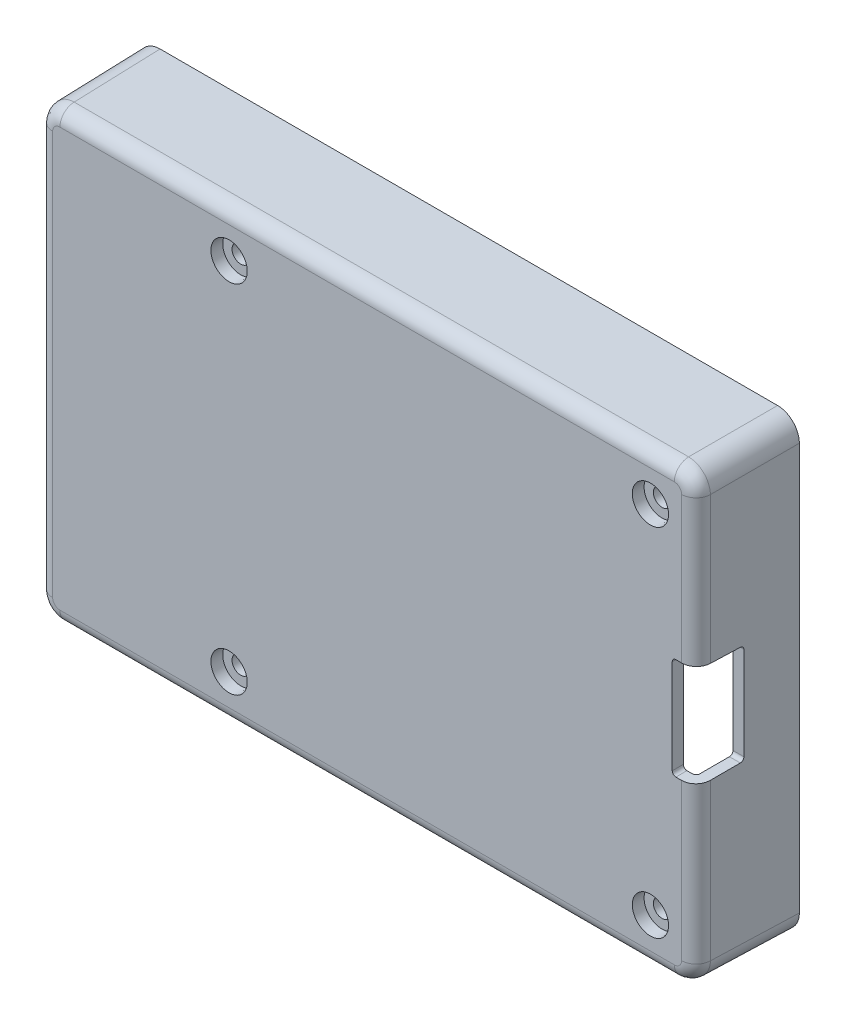
from build123d import *

# Parameters (mm, degrees)
SKETCH1_R                                        = 3.5
STANDOFFS_DEPTH                                  = 6
STANDOFFS_DRAFT                                  = -1
STANDOFFS_PROFILE_2_DEPTH                        = 6
STANDOFFS_PROFILE_2_DRAFT                        = -1
STANDOFFS_PROFILE_3_DEPTH                        = 6
STANDOFFS_PROFILE_3_DRAFT                        = -1
STANDOFFS_PROFILE_4_DEPTH                        = 6
STANDOFFS_PROFILE_4_DRAFT                        = -1
SKETCH2_W                                        = 91
SKETCH2_H                                        = 62
BASE_DEPTH                                       = 1.5
SKETCH3_W                                        = 91
SKETCH3_H                                        = 62
SKETCH3_W_2                                      = 88
SKETCH3_H_2                                      = 59
WALLS_DEPTH                                      = 12.5
CBORE_FOR_M2_PAN_HEAD_MACHINE_SCREW1_D           = 2.4
CBORE_FOR_M2_PAN_HEAD_MACHINE_SCREW1_CBORE_D     = 5
CBORE_FOR_M2_PAN_HEAD_MACHINE_SCREW1_CBORE_DEPTH = 1.6
SKETCH7_W                                        = 16
SKETCH7_H                                        = 6.92
SKETCH7_W_2                                      = 8.48
SKETCH7_H_2                                      = 7.06
SIDE_PORTS_DEPTH                                 = 56.634971016
SKETCH6_W                                        = 14.2
SKETCH6_H                                        = 17.304
SKETCH6_W_2                                      = 16.490000002
SKETCH6_H_2                                      = 14.78
ETHERNET_CUTS_DEPTH                              = 56.634971016
DRAFT2_ANGLE                                     = 1
DRAFT1_ANGLE                                     = -1
FILLET1_R                                        = 3
FILLET2_R                                        = 1.5
FILLET3_R                                        = 2
FILLET4_R                                        = 0.5
SD_START                                         = 42
SKETCH8_W                                        = 6.5
SKETCH8_H                                        = 14
SD_CARD_CUT_DEPTH                                = 14.634971168
DRAFT3_ANGLE                                     = 1
DRAFT4_ANGLE                                     = 1
DRAFT5_ANGLE                                     = 1
FILLET5_R                                        = 1
FILLET6_R                                        = 0.5


with BuildPart() as part:
    # Sketch1 → Standoffs (with draft: the straight prism first)
    with BuildSketch(Plane.XY):
        with Locations((-19, 24.5)):
            Circle(SKETCH1_R)
    extrude(amount=STANDOFFS_DEPTH)
    # Standoffs: the draft: its side faces are tilted about the plane it starts from
    standoffs_sides = [part.faces().sort_by_distance(p)[0] for p in [
        (-22.5, 24.5, 3),
    ]]
    draft(standoffs_sides, Plane.XY, STANDOFFS_DRAFT)



with BuildPart() as body_2:
    # Sketch1 → Standoffs profile 2 (with draft: the straight prism first)
    with BuildSketch(Plane.XY):
        with Locations((39, 24.5)):
            Circle(SKETCH1_R)
    extrude(amount=STANDOFFS_PROFILE_2_DEPTH)
    # Standoffs profile 2: the draft: its side faces are tilted about the plane it starts from
    standoffs_profile_2_sides = [body_2.faces().sort_by_distance(p)[0] for p in [
        (35.5, 24.5, 3),
    ]]
    draft(standoffs_profile_2_sides, Plane.XY, STANDOFFS_PROFILE_2_DRAFT)


with BuildPart() as body_3:
    # Sketch1 → Standoffs profile 3 (with draft: the straight prism first)
    with BuildSketch(Plane.XY):
        with Locations((39, -24.5)):
            Circle(SKETCH1_R)
    extrude(amount=STANDOFFS_PROFILE_3_DEPTH)
    # Standoffs profile 3: the draft: its side faces are tilted about the plane it starts from
    standoffs_profile_3_sides = [body_3.faces().sort_by_distance(p)[0] for p in [
        (35.5, -24.5, 3),
    ]]
    draft(standoffs_profile_3_sides, Plane.XY, STANDOFFS_PROFILE_3_DRAFT)


with BuildPart() as body_4:
    # Sketch1 → Standoffs profile 4 (with draft: the straight prism first)
    with BuildSketch(Plane.XY):
        with Locations((-19, -24.5)):
            Circle(SKETCH1_R)
    extrude(amount=STANDOFFS_PROFILE_4_DEPTH)
    # Standoffs profile 4: the draft: its side faces are tilted about the plane it starts from
    standoffs_profile_4_sides = [body_4.faces().sort_by_distance(p)[0] for p in [
        (-22.5, -24.5, 3),
    ]]
    draft(standoffs_profile_4_sides, Plane.XY, STANDOFFS_PROFILE_4_DRAFT)


with BuildPart() as part_1:
    add(part.part)

    add(body_2.part)  # Base merges body 2

    add(body_3.part)  # Base merges body 3

    add(body_4.part)  # Base merges body 4
    # Sketch2 → Base (add)
    with BuildSketch(Plane.XY.offset(6)):
        Rectangle(SKETCH2_W, SKETCH2_H)
    extrude(amount=-BASE_DEPTH)

    # Sketch3 → Walls (add)
    with BuildSketch(Plane(origin=(0, 0, 4.5), x_dir=(-1, 0, 0), z_dir=(0, 0, -1))):
        Rectangle(SKETCH3_W, SKETCH3_H)
        Rectangle(SKETCH3_W_2, SKETCH3_H_2, mode=Mode.SUBTRACT)
    extrude(amount=WALLS_DEPTH)

    # CBORE for M2 Pan Head Machine Screw1 (through all)
    with Locations(Plane.XY.offset(6)):
        with Locations((39, -24.5), (-19, 24.5), (39, 24.5), (-19, -24.5)):
            CounterBoreHole(CBORE_FOR_M2_PAN_HEAD_MACHINE_SCREW1_D / 2, CBORE_FOR_M2_PAN_HEAD_MACHINE_SCREW1_CBORE_D / 2, CBORE_FOR_M2_PAN_HEAD_MACHINE_SCREW1_CBORE_DEPTH)

    # Sketch7 → Side Ports (cut, through all)
    with BuildSketch(Plane(origin=(0, 0, 0), x_dir=(1, 0, 0), z_dir=(0, 1, 0))):
        with Locations((10.2, 4.76)):
            Rectangle(SKETCH7_W, SKETCH7_H)
        with Locations((31.75, 4.47)):
            Rectangle(SKETCH7_W_2, SKETCH7_H_2)
        with BuildLine():
            Line((-14.46458374, 8), (-14.4, 4.3))
            ThreePointArc((-14.4, 4.3), (-10.9, 0.8), (-7.4, 4.3))
            Line((-7.4, 4.3), (-7.33541626, 8))
            Line((-7.33541626, 8), (-14.46458374, 8))
        make_face()
    extrude(amount=-SIDE_PORTS_DEPTH, mode=Mode.SUBTRACT)

    # Sketch6 → Ethernet Cuts (cut, through all)
    with BuildSketch(Plane(origin=(0, 0, 0), x_dir=(0, 0, -1), z_dir=(1, 0, 0))):
        with Locations((8.7, -17.348)):
            Rectangle(SKETCH6_W, SKETCH6_H)
        with Locations((9.054999999, 1.25)):
            Rectangle(SKETCH6_W_2, SKETCH6_H_2)
        with Locations((9.054999999, 18.85)):
            Rectangle(SKETCH6_W_2, SKETCH6_H_2)
    extrude(amount=-ETHERNET_CUTS_DEPTH, mode=Mode.SUBTRACT)

    # Draft2
    draft2_faces = [part_1.faces().sort_by_distance(p)[0] for p in [
        (-44, -0.518509944, 0.427737863),
        (0, 29.5, -1.75),
        (44, 0, -1.75),
        (-2.816313672, -29.5, -1.063428714),
    ]]
    draft(draft2_faces, Plane(origin=(0, 0, -8), x_dir=(-1, 0, 0), z_dir=(0, 0, -1)), DRAFT2_ANGLE)

    # Draft1
    draft1_faces = [part_1.faces().sort_by_distance(p)[0] for p in [
        (-45.5, -0.394288699, 1.101123374),
        (0, 31, -1),
        (45.5, 0, -1),
        (-2.354688138, -31, -0.275866557),
    ]]
    draft(draft1_faces, Plane(origin=(0, 0, -8), x_dir=(-1, 0, 0), z_dir=(0, 0, -1)), DRAFT1_ANGLE)

    # Fillet1
    fillet1_edges = [part_1.edges().sort_by_distance(p)[0] for p in [
        (-45.377814545, -30.877814545, -1),
        (45.377814545, -30.877814545, -1),
        (45.377814545, 30.877814545, -1),
        (-45.377814545, 30.877814545, -1),
    ]]
    fillet(fillet1_edges, radius=FILLET1_R)

    # Fillet2
    fillet2_edges = [part_1.edges().sort_by_distance(p)[0] for p in [
        (-43.890905844, -29.390905844, -1.75),
        (-43.890905844, 29.390905844, -1.75),
        (43.890905844, 29.390905844, -1.75),
        (43.890905844, -29.390905844, -1.75),
    ]]
    fillet(fillet2_edges, radius=FILLET2_R)

    # Fillet3
    fillet3_edges = [part_1.edges().sort_by_distance(p)[0] for p in [
        (44.377138674, 29.877138674, 6),
        (45.255629091, 0, 6),
        (44.377138674, -29.877138674, 6),
        (0, -30.755629091, 6),
        (-44.377138674, -29.877138674, 6),
        (-45.255629091, 0, 6),
        (-44.377138674, 29.877138674, 6),
        (0, 30.755629091, 6),
    ]]
    fillet(fillet3_edges, radius=FILLET3_R)

    # Fillet4
    fillet4_edges = [part_1.edges().sort_by_distance(p)[0] for p in [
        (-22.578547792, 24.5, 4.5),
        (35.421452208, 24.5, 4.5),
        (35.421452208, -24.5, 4.5),
        (-22.578547792, -24.5, 4.5),
        (43.34256648, -28.84256648, 4.5),
        (43.781811688, 0, 4.5),
        (43.34256648, 28.84256648, 4.5),
        (0, 29.281811688, 4.5),
        (-43.34256648, 28.84256648, 4.5),
        (-43.781811688, 0, 4.5),
        (-43.34256648, -28.84256648, 4.5),
        (0, -29.281811688, 4.5),
    ]]
    fillet(fillet4_edges, radius=FILLET4_R)

    # Sketch8 → SD Card Cut (cut, through all)
    with BuildSketch(Plane(origin=(0, 0, 0), x_dir=(0, 0, -1), z_dir=(1, 0, 0)).offset(SD_START)):
        with Locations((-2.75, 0.7)):
            Rectangle(SKETCH8_W, SKETCH8_H)
    extrude(amount=SD_CARD_CUT_DEPTH, mode=Mode.SUBTRACT)

    # Draft3
    draft3_faces = [part_1.faces().sort_by_distance(p)[0] for p in [
        (2.2, -30.191525532, -4.65),
        (27.51, -30.188383621, -4.47),
        (18.2, -30.191525532, -4.65),
        (35.99, -30.188383621, -4.47),
        (-44.687249042, 11.46, -4.404999999),
        (-44.687249042, -6.14, -4.404999999),
        (-44.694143792, -26, -4.8),
        (-44.687249042, 8.64, -4.404999999),
        (-44.694143792, -8.696, -4.8),
        (-44.687249042, 26.24, -4.404999999),
    ]]
    draft(draft3_faces, Plane(origin=(0, 0, -8), x_dir=(-1, 0, 0), z_dir=(0, 0, -1)), DRAFT3_ANGLE)

    # Draft4
    draft4_faces = [part_1.faces().sort_by_distance(p)[0] for p in [
        (42, 0.7, 5.25),
        (44.157016065, -6.3, 3.127866158),
        (44.157016065, 7.7, 3.127866158),
    ]]
    draft(draft4_faces, Plane(origin=(-19, 24.5, 6), x_dir=(1, 0, 0), z_dir=(0, 0, 1)), DRAFT4_ANGLE)

    # Draft5
    draft5_faces = [part_1.faces().sort_by_distance(p)[0] for p in [
        (36.5, 24.5, 5.2),
        (-21.5, -24.5, 5.2),
        (-21.5, 24.5, 5.2),
        (36.5, -24.5, 5.2),
    ]]
    draft(draft5_faces, Plane(origin=(-19, 24.5, 6), x_dir=(1, 0, 0), z_dir=(0, 0, 1)), DRAFT5_ANGLE)

    # Fillet5
    fillet5_edges = [part_1.edges().sort_by_distance(p)[0] for p in [
        (27.633232758, -30.126767242, -0.94),
        (2.316948935, -30.133051065, -1.3),
        (18.083051065, -30.133051065, -1.3),
        (35.866767242, -30.126767242, -0.94),
    ]]
    fillet(fillet5_edges, radius=FILLET5_R)

    # Fillet6
    fillet6_edges = [part_1.edges().sort_by_distance(p)[0] for p in [
        (44.619087013, -6.186542078, -0.5),
        (42.013091299, -6.286908701, 5.25),
        (42.013091299, 7.686908701, 5.25),
        (44.619087013, 7.586542078, -0.5),
        (-44.624498083, 11.585501917, -0.809999998),
        (-44.624498083, -6.014498083, -0.809999998),
        (-44.638287584, -25.888287584, -1.6),
        (-44.638287584, -8.807712416, -1.6),
        (-44.624498083, 8.514498083, -0.809999998),
        (-44.624498083, 26.114498083, -0.809999998),
    ]]
    fillet(fillet6_edges, radius=FILLET6_R)


solid = part_1.part
